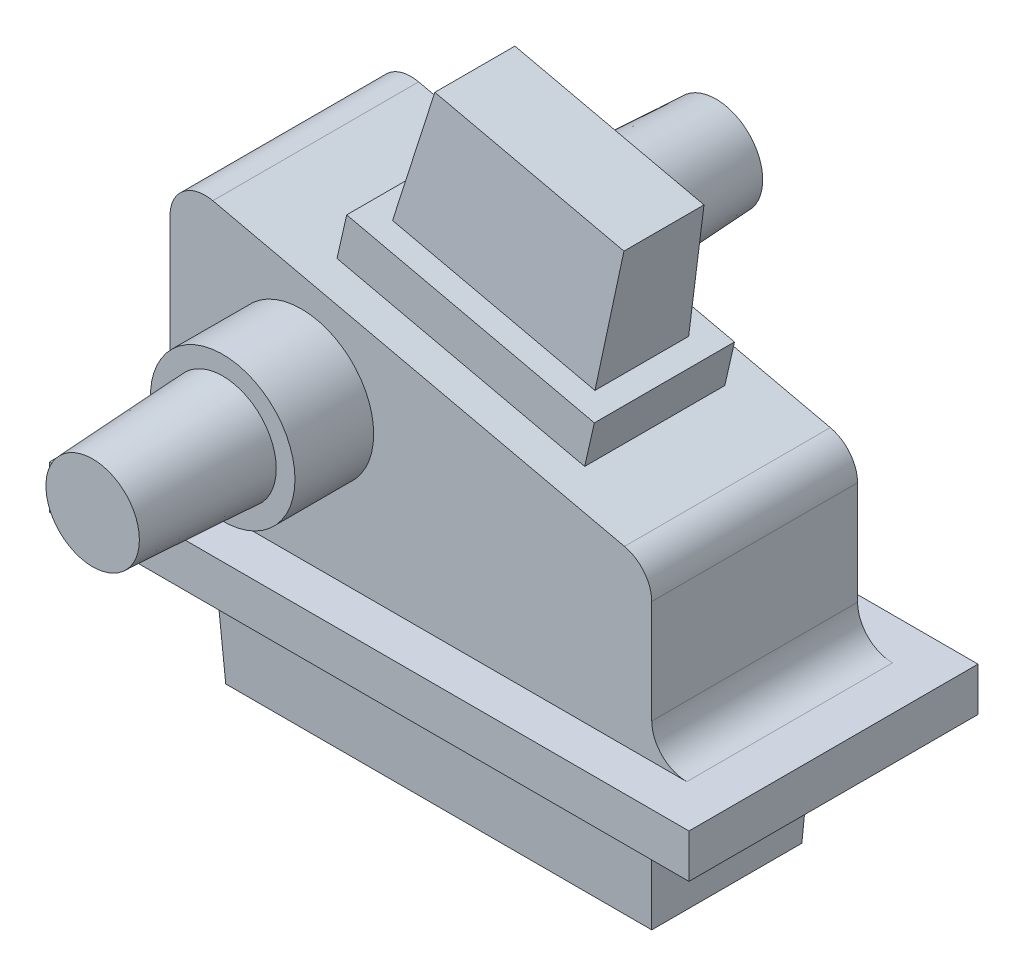
from build123d import *

# Parameters (mm, degrees)
BOSS_EXTRUDE1_DEPTH      = 23.5
BOSS_EXTRUDE2_DEPTH      = 15
BOSS_EXTRUDE2_DEPTH_BACK = 62
SKETCH2_R                = 16.5
CUT_EXTRUDE1_DEPTH       = 18.5
SKETCH4_R                = 15
CUT_EXTRUDE2_DEPTH       = 128.114121953
FILLET1_R                = 8
SKETCH5_W                = 58
SKETCH5_H                = 32
BOSS_EXTRUDE3_DEPTH      = 7
CUT_EXTRUDE4_REACH       = 115.269
SKETCH6_W                = 47
SKETCH6_H                = 21
SKETCH7_W                = 146
SKETCH7_H                = 66
SKETCH7_W_2              = 100
SKETCH7_H_2              = 37
BOSS_EXTRUDE5_DEPTH      = 7
SCALE1_SCALE             = 1.01
MOVE_START               = -33.33
MOVE_FACE1_OUTLINE_W     = 147.46
MOVE_FACE1_OUTLINE_H     = 3
MOVE_FACE1_OUTLINE_R     = 15.15
MOVE_FACE1_OUTLINE_R_2   = 12.15
MOVE_FACE1_DEPTH         = 14.645
MOVE_START_2             = 18.685
MOVE_FACE1_2_OUTLINE_W   = 147.46
MOVE_FACE1_2_OUTLINE_H   = 3
MOVE_FACE1_2_OUTLINE_R   = 15.15
MOVE_FACE1_2_OUTLINE_R_2 = 12.15
MOVE_FACE1_2_DEPTH       = 14.645
MOVE_START_3             = -16.16
MOVE_FACE1_3_OUTLINE_W   = 23.23
MOVE_FACE1_3_OUTLINE_H   = 3
MOVE_FACE1_3_DEPTH       = 32.32
MOVE_START_4             = -41.885
MOVE_FACE1_4_OUTLINE_R   = 16.665
MOVE_FACE1_4_OUTLINE_R_2 = 12.15
MOVE_FACE1_4_DEPTH       = 8.555
MOVE_START_5             = 33.33
MOVE_FACE1_5_OUTLINE_R   = 16.665
MOVE_FACE1_5_OUTLINE_R_2 = 12.15
MOVE_FACE1_5_DEPTH       = 8.555
MOVE_FACE1_6_DEPTH       = 5.555
MOVE_START_6             = 10.605
MOVE_FACE1_7_DEPTH       = 5.555
MOVE_START_7             = -18.685
MOVE_FACE1_8_OUTLINE_W   = 23.23
MOVE_FACE1_8_OUTLINE_H   = 3
MOVE_FACE1_8_DEPTH       = 37.37
SKETCH8_R                = 12.35
BOSS_EXTRUDE6_DEPTH      = 30
BOSS_EXTRUDE6_TAPER      = 3
SKETCH9_R                = 12.35
BOSS_EXTRUDE7_DEPTH      = 30
BOSS_EXTRUDE7_TAPER      = 3
SKETCH12_W               = 47.87
SKETCH12_H               = 21.61
BOSS_EXTRUDE10_DEPTH     = 30
BOSS_EXTRUDE10_TAPER     = 3
SKETCH11_W               = 101.4
SKETCH11_H               = 37.77
BOSS_EXTRUDE9_DEPTH      = 30
BOSS_EXTRUDE9_TAPER      = 3


# Read off the part's stored shape, not the designer's step: Move Face1
with BuildPart() as part:
    # Sketch1 → Boss-Extrude1 (new, symmetric)
    with BuildSketch(Plane.XY):
        with BuildLine():
            Line((-73, 0), (73, 0))
            Line((73, 0), (73, 7))
            Line((73, 7), (63, 7))
            ThreePointArc((63, 7), (57.343145751, 9.343145751), (55, 15))
            Line((55, 15), (55, 45))
            Line((55, 45), (-55, 70))
            Line((-55, 70), (-55, 15))
            ThreePointArc((-55, 15), (-57.343145751, 9.343145751), (-63, 7))
            Line((-63, 7), (-73, 7))
            Line((-73, 7), (-73, 0))
        make_face()
    extrude(amount=BOSS_EXTRUDE1_DEPTH, both=True)

    # Sketch2 → Boss-Extrude2 (add, two sides: drawn at the far end of the back side and taken through both)
    with BuildSketch(Plane.XY.offset(23.5).offset(-BOSS_EXTRUDE2_DEPTH_BACK)):
        with Locations((-25, 40)):
            Circle(SKETCH2_R)
    extrude(amount=BOSS_EXTRUDE2_DEPTH + BOSS_EXTRUDE2_DEPTH_BACK)

    # Sketch3 → Cut-Extrude1 (cut, symmetric)
    with BuildSketch(Plane.XY):
        with BuildLine():
            Line((-50, 0), (-50, 54.753788749))
            ThreePointArc((-50, 54.753788749), (-46.923297675, 61.059432253), (-40.059715, 62.51492875))
            Line((-40.059715, 62.51492875), (43.940285, 41.51492875))
            ThreePointArc((43.940285, 41.51492875), (48.305643504, 38.677086424), (50, 33.753788749))
            Line((50, 33.753788749), (50, 0))
            Line((50, 0), (-50, 0))
        make_face()
    extrude(amount=CUT_EXTRUDE1_DEPTH, both=True, mode=Mode.SUBTRACT)

    # Sketch4 → Cut-Extrude2 (cut, through all)
    with BuildSketch(Plane.XY.offset(38.5)):
        with Locations((-25, 40)):
            Circle(SKETCH4_R)
    extrude(amount=-CUT_EXTRUDE2_DEPTH, mode=Mode.SUBTRACT)

    # Fillet1
    fillet1_edges = [part.edges().sort_by_distance(p)[0] for p in [
        (-55, 70, 0),
        (55, 45, 0),
    ]]
    fillet(fillet1_edges, radius=FILLET1_R)

    # Sketch5 → Boss-Extrude3 (add)
    with BuildSketch(Plane(origin=(12.42632613, 54.675834971, 0), x_dir=(0.9751328557914598, -0.2216211035889682, 0), z_dir=(0.22162110358896822, 0.9751328557914599, 0))):
        with Locations((-8.736046198, 0)):
            Rectangle(SKETCH5_W, SKETCH5_H)
    extrude(amount=BOSS_EXTRUDE3_DEPTH)

    # Cut-Extrude4: up to this plane
    cut_extrude4_end = Plane(origin=(-40.059715, 62.51492875, -18.5), z_dir=(0.24253562503633289, 0.970142500145332, 0))
    # Sketch6 → Cut-Extrude4 (cut, up to the surface)
    with BuildSketch(Plane(origin=(13.977673855, 61.501764961, 0), x_dir=(0.9751328557914598, -0.2216211035889683, 0), z_dir=(0.2216211035889683, 0.9751328557914598, 0)), mode=Mode.PRIVATE) as cut_extrude4_sk1:
        with Locations((-8.736046198, 0)):
            Rectangle(SKETCH6_W, SKETCH6_H)
    cut_extrude4_tool1 = split(extrude(cut_extrude4_sk1.sketch, amount=-CUT_EXTRUDE4_REACH, mode=Mode.PRIVATE), bisect_by=cut_extrude4_end, keep=Keep.BOTH, mode=Mode.PRIVATE)
    add(cut_extrude4_tool1.solids().sort_by_distance((5.458868, 63.437857, 0))[0], mode=Mode.SUBTRACT)

    # Sketch7 → Boss-Extrude5 (add)
    with BuildSketch(Plane.XZ):
        Rectangle(SKETCH7_W, SKETCH7_H)
        Rectangle(SKETCH7_W_2, SKETCH7_H_2, mode=Mode.SUBTRACT)
    extrude(amount=-BOSS_EXTRUDE5_DEPTH)


with BuildPart() as part_1:
    # Scale1: scaled about (-2.483179367, 26.747657508, 0)
    add(part.part.scale(SCALE1_SCALE).moved(Location((0.024831794, -0.267476575, 0))))

    # Move Face1 outline → Move Face1 (add)
    # profile 1 of 2: a face of its own
    with BuildSketch(Plane.XY.offset(MOVE_START)):
        with Locations((0.024831794, -1.767476575)):
            Rectangle(MOVE_FACE1_OUTLINE_W, MOVE_FACE1_OUTLINE_H)
    # profile 2 of 2: a face of its own
    with BuildSketch(Plane.XY.offset(MOVE_START)):
        with Locations((-25.225168206, 40.132523425)):
            Circle(MOVE_FACE1_OUTLINE_R)
        with Locations((-25.225168206, 40.132523425)):
            Circle(MOVE_FACE1_OUTLINE_R_2, mode=Mode.SUBTRACT)
    extrude(amount=MOVE_FACE1_DEPTH)

    # Move Face1 2 outline → Move Face1 2 (add)
    # profile 1 of 2: a face of its own
    with BuildSketch(Plane.XY.offset(MOVE_START_2)):
        with Locations((0.024831794, -1.767476575)):
            Rectangle(MOVE_FACE1_2_OUTLINE_W, MOVE_FACE1_2_OUTLINE_H)
    # profile 2 of 2: a face of its own
    with BuildSketch(Plane.XY.offset(MOVE_START_2)):
        with Locations((-25.225168206, 40.132523425)):
            Circle(MOVE_FACE1_2_OUTLINE_R)
        with Locations((-25.225168206, 40.132523425)):
            Circle(MOVE_FACE1_2_OUTLINE_R_2, mode=Mode.SUBTRACT)
    extrude(amount=MOVE_FACE1_2_DEPTH)

    # Move Face1 3 outline → Move Face1 3 (add)
    with BuildSketch(Plane.XY.offset(MOVE_START_3)):
        with Locations((62.139831794, -1.767476575)):
            Rectangle(MOVE_FACE1_3_OUTLINE_W, MOVE_FACE1_3_OUTLINE_H)
        with Locations((-62.090168206, -1.767476575)):
            Rectangle(MOVE_FACE1_3_OUTLINE_W, MOVE_FACE1_3_OUTLINE_H)
        Polygon((34.099929999, 57.313477033), (34.76479331, 60.2388756), (29.347930296, 61.46998083), (28.683066985, 58.544582263), align=None)
        Polygon((-17.606489679, 69.064936051), (-16.941626368, 71.990334618), (-22.358489382, 73.221439848), (-23.023352693, 70.296041281), align=None)
    extrude(amount=MOVE_FACE1_3_DEPTH)

    # Move Face1 4 outline → Move Face1 4 (add)
    with BuildSketch(Plane.XY.offset(MOVE_START_4)):
        with Locations((-25.225168206, 40.132523425)):
            Circle(MOVE_FACE1_4_OUTLINE_R)
        with Locations((-25.225168206, 40.132523425)):
            Circle(MOVE_FACE1_4_OUTLINE_R_2, mode=Mode.SUBTRACT)
    extrude(amount=MOVE_FACE1_4_DEPTH)

    # Move Face1 5 outline → Move Face1 5 (add)
    with BuildSketch(Plane.XY.offset(MOVE_START_5)):
        with Locations((-25.225168206, 40.132523425)):
            Circle(MOVE_FACE1_5_OUTLINE_R)
        with Locations((-25.225168206, 40.132523425)):
            Circle(MOVE_FACE1_5_OUTLINE_R_2, mode=Mode.SUBTRACT)
    extrude(amount=MOVE_FACE1_5_DEPTH)

    # Move Face1 6 outline → Move Face1 6 (add)
    with BuildSketch(Plane.XY.offset(MOVE_START_3)):
        Polygon((28.683066985, 58.544582263), (29.347930296, 61.469980831), (-16.941626368, 71.990334618), (-17.606489679, 69.064936051), align=None)
    extrude(amount=MOVE_FACE1_6_DEPTH)

    # Move Face1 7 outline → Move Face1 7 (add)
    with BuildSketch(Plane.XY.offset(MOVE_START_6)):
        Polygon((28.683066985, 58.544582263), (29.347930296, 61.469980831), (-16.941626368, 71.990334618), (-17.606489679, 69.064936051), align=None)
    extrude(amount=MOVE_FACE1_7_DEPTH)

    # Move Face1 8 outline → Move Face1 8 (add)
    with BuildSketch(Plane.XY.offset(MOVE_START_7)):
        with Locations((62.139831794, -1.767476575)):
            Rectangle(MOVE_FACE1_8_OUTLINE_W, MOVE_FACE1_8_OUTLINE_H)
        with Locations((-62.090168206, -1.767476575)):
            Rectangle(MOVE_FACE1_8_OUTLINE_W, MOVE_FACE1_8_OUTLINE_H)
    extrude(amount=MOVE_FACE1_8_DEPTH)

    # Sketch12 → Boss-Extrude10 (add)
    with BuildSketch(Plane(origin=(14.725729172, 64.793208359, 0), x_dir=(0.9751328557914598, -0.2216211035889683, 0), z_dir=(0.2216211035889683, 0.9751328557914598, 0))):
        with Locations((-8.739913908, 0)):
            Rectangle(SKETCH12_W, SKETCH12_H)
    extrude(amount=BOSS_EXTRUDE10_DEPTH, taper=BOSS_EXTRUDE10_TAPER)


with BuildPart() as body_2:
    # Sketch8 → Boss-Extrude6 (new body)
    with BuildSketch(Plane.XY.offset(41.885)):
        with Locations((-25.225168206, 40.132523425)):
            Circle(SKETCH8_R)
    extrude(amount=BOSS_EXTRUDE6_DEPTH, taper=BOSS_EXTRUDE6_TAPER)


with BuildPart() as body_3:
    # Sketch9 → Boss-Extrude7 (new body)
    with BuildSketch(Plane(origin=(0, 0, -41.885), x_dir=(-1, 0, 0), z_dir=(0, 0, -1))):
        with Locations((25.225168206, 40.132523425)):
            Circle(SKETCH9_R)
    extrude(amount=BOSS_EXTRUDE7_DEPTH, taper=BOSS_EXTRUDE7_TAPER)


with BuildPart() as body_4:
    # Sketch11 → Boss-Extrude9 (new body)
    with BuildSketch(Plane.XZ.offset(3.267476575)):
        with Locations((0.024831794, 0)):
            Rectangle(SKETCH11_W, SKETCH11_H)
    extrude(amount=BOSS_EXTRUDE9_DEPTH, taper=BOSS_EXTRUDE9_TAPER)


solid = Compound([part_1.part, body_2.part, body_3.part, body_4.part])
